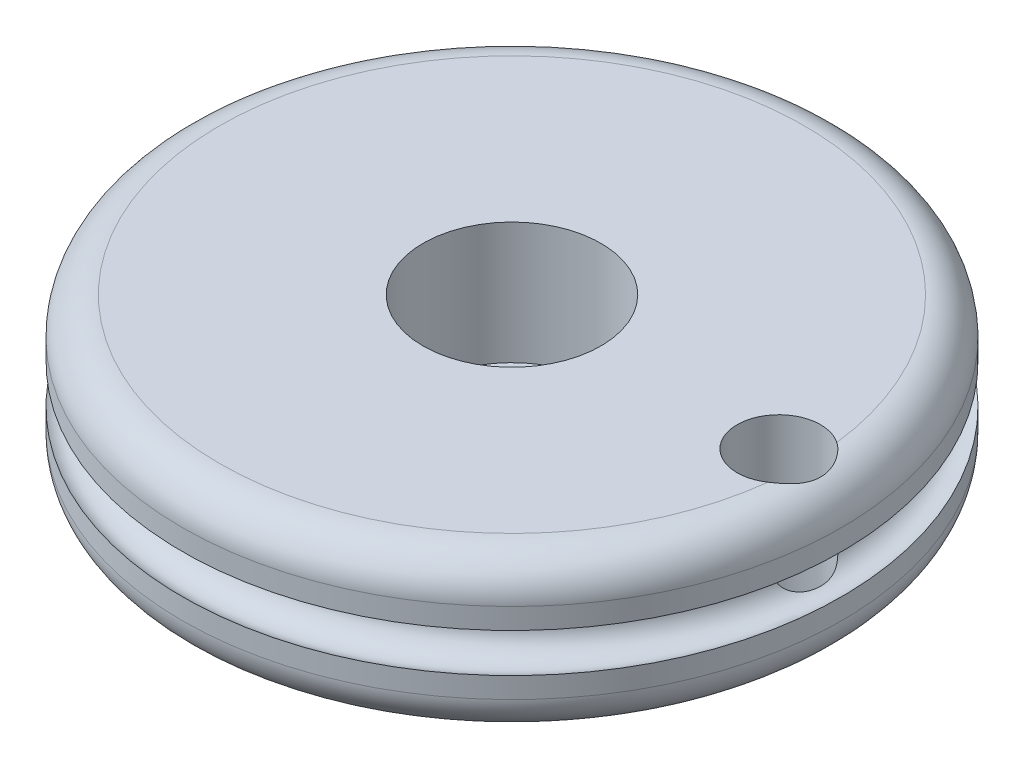
from build123d import *

# Parameters (mm, degrees)
SKETCH1_R            = 8.89
SKETCH1_R_2          = 0.9
SKETCH1_R_3          = 1.125
BOSS_EXTRUDE1_DEPTH  = 4.175
SKETCH2_R            = 2.4
CUT_EXTRUDE1_DEPTH   = 3.286
CUT_SWEEP1_PROFILE_R = 0.615
FILLET1_R            = 1


with BuildPart() as part:
    # Sketch1 → Boss-Extrude1 (new body)
    with BuildSketch(Plane(origin=(0, 0, 0), x_dir=(1, 0, 0), z_dir=(0, 1, 0))):
        with Locations(Location((0, 0, 0), (0, 0, 270))):
            Circle(SKETCH1_R)
        with Locations(Location((0, 0, 0), (0, 0, 270))):
            Circle(SKETCH1_R_2, mode=Mode.SUBTRACT)
        with Locations(Location((7.2, 0, 0), (0, 0, 270))):
            Circle(SKETCH1_R_3, mode=Mode.SUBTRACT)
    extrude(amount=BOSS_EXTRUDE1_DEPTH)

    # Sketch2 → Cut-Extrude1 (cut)
    with BuildSketch(Plane(origin=(0, 4.175, 0), x_dir=(1, 0, 0), z_dir=(0, 1, 0))):
        with Locations(Location((0, 0, 0), (0, 0, 270))):
            Circle(SKETCH2_R)
    extrude(amount=-CUT_EXTRUDE1_DEPTH, mode=Mode.SUBTRACT)

    # Cut-Sweep1: sweep along a path in Sketch3
    with BuildLine(Plane(origin=(0, 2.0875, 0), x_dir=(-1, 0, 0), z_dir=(0, -1, 0))) as cut_sweep1_path:
        CenterArc((0, 0), 8.5725, 0, 360)
    # Cut-Sweep1 profile (on start of the path) → Cut-Sweep1 (sweep, cut)
    with BuildSketch(Plane(origin=(-8.5725, 2.0875, 0), x_dir=(-1, 0, 0), z_dir=(0, 0, -1))):
        Circle(CUT_SWEEP1_PROFILE_R)
    sweep(path=cut_sweep1_path.line, mode=Mode.SUBTRACT)

    # Fillet1
    # the kernel refuses this fillet: 1 mm, written as the material it takes off along each edge
    with BuildSketch(Plane(origin=(0, 0, 0), x_dir=(0, 0, 1), z_dir=(-1, 0, 0))) as fillet1_piece_1:
        with BuildLine():
            CenterArc((8.89 - FILLET1_R, FILLET1_R), FILLET1_R, 270, 90)
            Line((8.89 - FILLET1_R, 0), (8.89, 0))
            Line((8.89, 0), (8.89, FILLET1_R))
        make_face()
    revolve(axis=Axis((0, 0, 0), (0, 1, 0)), mode=Mode.SUBTRACT)
    with BuildSketch(Plane(origin=(0, 4.175, 0), x_dir=(0, 0, 1), z_dir=(-1, 0, 0))) as fillet1_piece_2:
        with BuildLine():
            CenterArc((8.89 - FILLET1_R, -FILLET1_R), FILLET1_R, 0, 90)
            Line((8.89 - FILLET1_R, 0), (8.89, 0))
            Line((8.89, 0), (8.89, -FILLET1_R))
        make_face()
    revolve(axis=Axis((0, 4.175, 0), (0, 1, 0)), mode=Mode.SUBTRACT)


solid = part.part
